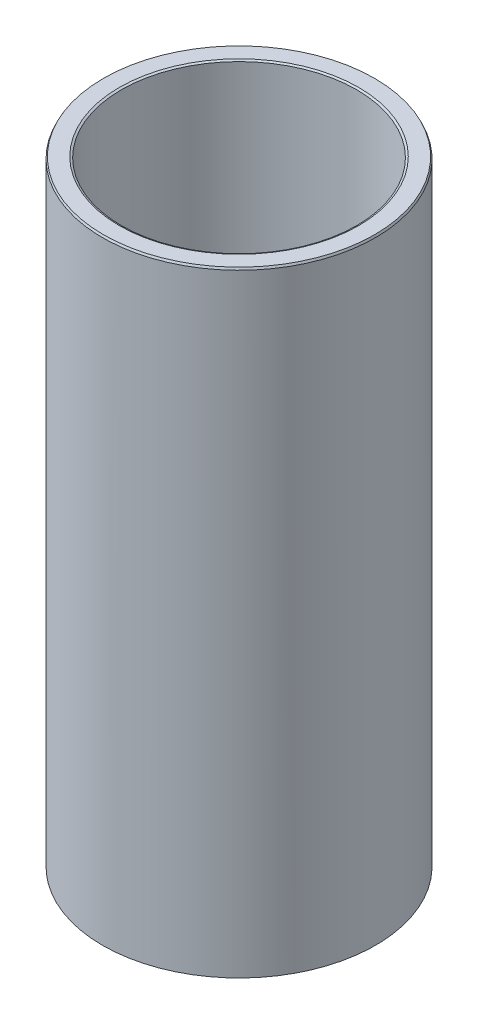
from build123d import *
from OCP.BRepFilletAPI import BRepFilletAPI_MakeChamfer

# Parameters (mm, degrees)
SKETCH1_R           = 45
BOSS_EXTRUDE1_DEPTH = 203.05795667
SKETCH2_R           = 38.799147936
CUT_EXTRUDE1_DEPTH  = 213.796930821
CHAMFER1_SIZE       = 0.66247426
CHAMFER1_SIZE2      = 0.323366757


with BuildPart() as part:
    # Sketch1 → Boss-Extrude1 (new body)
    with BuildSketch(Plane(origin=(0, 0, 0), x_dir=(1, 0, 0), z_dir=(0, 1, 0))):
        Circle(SKETCH1_R)
    extrude(amount=BOSS_EXTRUDE1_DEPTH)

    # Sketch2 → Cut-Extrude1 (cut, through all)
    with BuildSketch(Plane(origin=(0, 0, 0), x_dir=(1, 0, 0), z_dir=(0, 1, 0))):
        Circle(SKETCH2_R)
    extrude(amount=CUT_EXTRUDE1_DEPTH, mode=Mode.SUBTRACT)

    # Chamfer1: one chamfer whose edges measure the first distance from different faces: ONE call of the kernel's chamfer builder (chamfer() names one face for all edges)
    chamfer1_edges_1 = [part.edges().sort_by_distance(p)[0] for p in [
        (-38.799147936, 203.05795667, 0),
    ]]
    chamfer1_side_1 = [part.faces().sort_by_distance(p)[0] for p in [
        (-43.727207794, 203.05795667, 0),
    ]]
    chamfer1_edges_2 = [part.edges().sort_by_distance(p)[0] for p in [
        (-38.799147936, 0, 0),
    ]]
    chamfer1_side_2 = [part.faces().sort_by_distance(p)[0] for p in [
        (-38.799147936, 101.528978335, 0),
    ]]
    chamfer1_edges_3 = [part.edges().sort_by_distance(p)[0] for p in [
        (-45, 0, 0),
    ]]
    chamfer1_side_3 = [part.faces().sort_by_distance(p)[0] for p in [
        (-43.727207794, 0, 0),
    ]]
    chamfer1_edges_4 = [part.edges().sort_by_distance(p)[0] for p in [
        (-45, 203.05795667, 0),
    ]]
    chamfer1_side_4 = [part.faces().sort_by_distance(p)[0] for p in [
        (-45, 101.528978335, 0),
    ]]
    chamfer1 = BRepFilletAPI_MakeChamfer(part.part.solid().wrapped)
    for e in chamfer1_edges_1:
        chamfer1.Add(CHAMFER1_SIZE, CHAMFER1_SIZE2, e.wrapped, chamfer1_side_1[0].wrapped)  # the first distance lies on this face
    for e in chamfer1_edges_2:
        chamfer1.Add(CHAMFER1_SIZE, CHAMFER1_SIZE2, e.wrapped, chamfer1_side_2[0].wrapped)  # the first distance lies on this face
    for e in chamfer1_edges_3:
        chamfer1.Add(CHAMFER1_SIZE, CHAMFER1_SIZE2, e.wrapped, chamfer1_side_3[0].wrapped)  # the first distance lies on this face
    for e in chamfer1_edges_4:
        chamfer1.Add(CHAMFER1_SIZE, CHAMFER1_SIZE2, e.wrapped, chamfer1_side_4[0].wrapped)  # the first distance lies on this face
    add(Compound.cast(chamfer1.Shape()), mode=Mode.REPLACE)


solid = part.part
